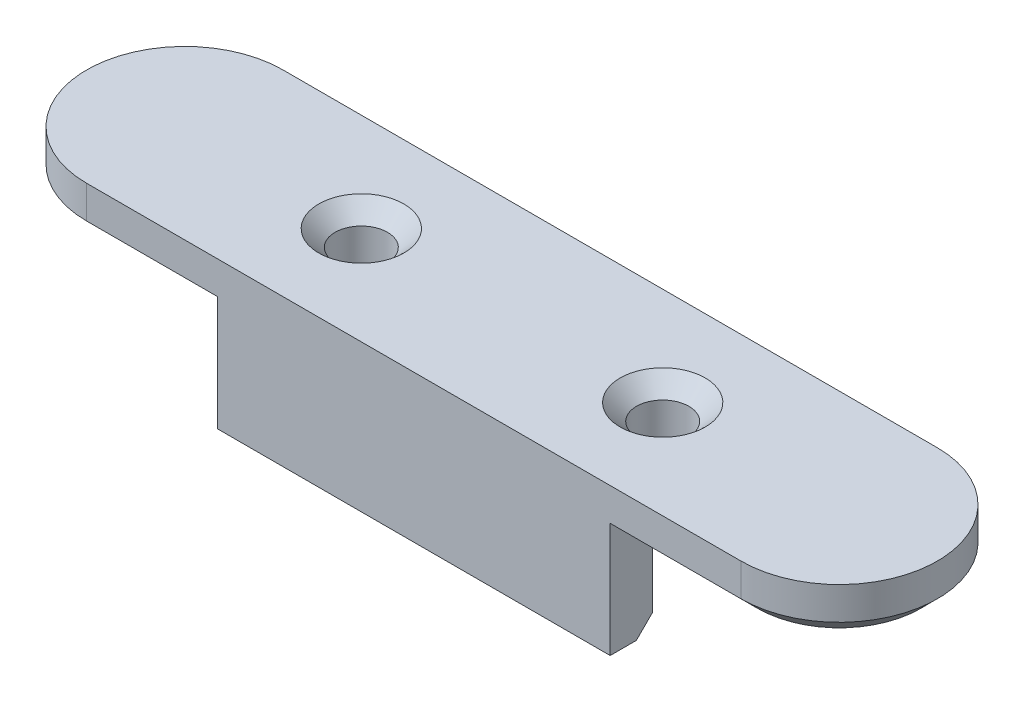
from build123d import *

# Parameters (mm, degrees)
BOSS_EXTRUDE1_DEPTH     = 3
SKETCH6_W               = 12
SKETCH6_H               = 2.6
BOSS_EXTRUDE3_DEPTH     = 6
CUT_EXTRUDE1_DEPTH      = 28.349588662
CUT_EXTRUDE1_DEPTH_BACK = 28.349588662
SKETCH4_R               = 1.6
CHAMFER1_SIZE           = 1
CHAMFER3_SIZE           = 1


with BuildPart() as part:
    # Sketch1 → Boss-Extrude1 (new body)
    with BuildSketch(Plane(origin=(0, 0, 0), x_dir=(1, 0, 0), z_dir=(0, 1, 0))):
        with BuildLine():
            Line((0, 6), (-20, 6))
            ThreePointArc((-20, 6), (-26, 0), (-20, -6))
            Line((-20, -6), (0, -6))
            Line((0, -6), (0, 6))
        make_face()
    extrude(amount=BOSS_EXTRUDE1_DEPTH)

    # Sketch2 → Cut-Revolve1 (revolve, cut)
    with BuildSketch(Plane.XY):
        with BuildLine():
            Line((-20, 1), (-20, 0))
            Line((-20, 0), (-23.31662479, 0))
            ThreePointArc((-23.31662479, 0), (-21.732050808, 0.744562647), (-20, 1))
        make_face()
    revolve(axis=Axis((-20, -4.110143275, 0), (0, 1, 0)), mode=Mode.SUBTRACT)

    # Sketch6 → Boss-Extrude3 (add)
    with BuildSketch(Plane.XZ):
        with Locations((-6, 4.7)):
            Rectangle(SKETCH6_W, SKETCH6_H)
    boss_extrude3 = extrude(amount=BOSS_EXTRUDE3_DEPTH)

    # Mirror2: Boss-Extrude3 across plane
    add(boss_extrude3.mirror(Plane.XY))

    # Sketch4 → Cut-Extrude1 (cut, two sides: drawn at the far end of the back side and taken through both)
    with BuildSketch(Plane(origin=(0, 0, 0), x_dir=(1, 0, 0), z_dir=(0, 1, 0)).offset(-CUT_EXTRUDE1_DEPTH_BACK)):
        with Locations((-9.210618834, 0)):
            Circle(SKETCH4_R)
    extrude(amount=CUT_EXTRUDE1_DEPTH + CUT_EXTRUDE1_DEPTH_BACK, mode=Mode.SUBTRACT)

    # Chamfer1
    chamfer1_edges = [part.edges().sort_by_distance(p)[0] for p in [
        (-10.810618834, 3, 0),
    ]]
    chamfer(chamfer1_edges, length=CHAMFER1_SIZE)

    # Mirror1: part across plane


with BuildPart() as part_1:
    add(part.part)
    add(part.part.mirror(Plane(origin=(0, 0, 0), x_dir=(0, 0, 1), z_dir=(1, 0, 0))))

    # Chamfer3
    chamfer3_edges = [part_1.edges().sort_by_distance(p)[0] for p in [
        (-16, 0, -6),
        (-16, 0, 6),
        (-26, 0, 0),
        (16, 0, -6),
        (16, 0, 6),
        (26, 0, 0),
        (0, -6, -3.4),
        (0, -6, 3.4),
    ]]
    chamfer(chamfer3_edges, length=CHAMFER3_SIZE)


solid = part_1.part
